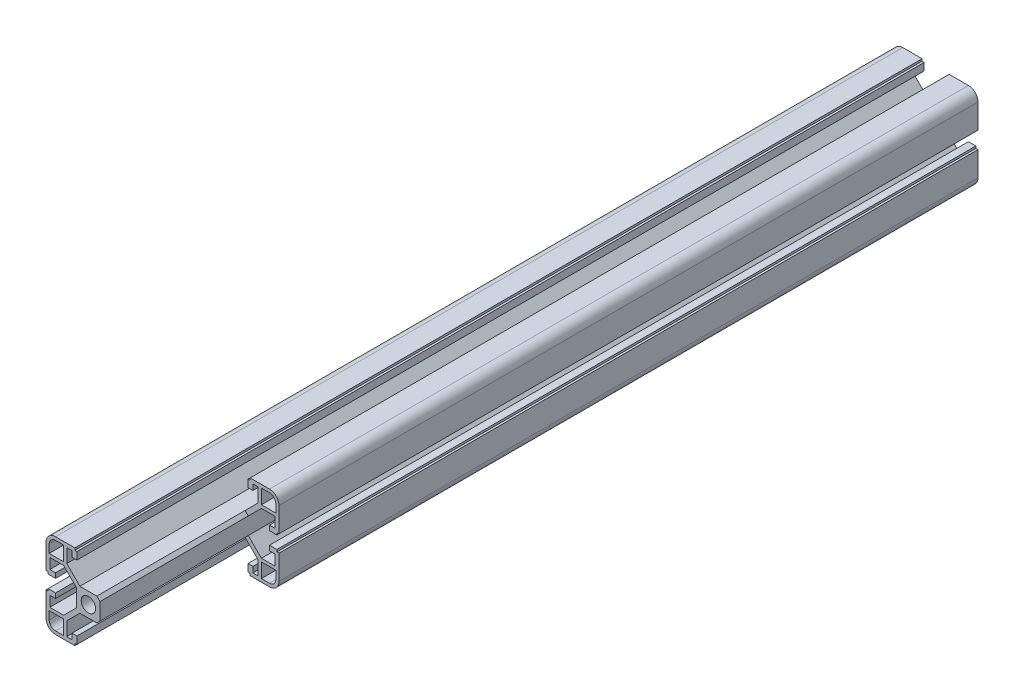
from build123d import *
from build123d.topology import SkipClean

# Parameters (mm, degrees)
BOSS_EXTRUDE1_DEPTH   = 400
MIRROR3_COPY_1_DEPTH  = 400
MIRROR3_COPY_2_DEPTH  = 400
CORTAR_EXTRUIR2_DEPTH = 70


with BuildPart() as part:
    # Sketch1 → Boss-Extrude1 (new body)
    with BuildSketch(Plane.XY):
        with BuildLine():
            Line((3.4, 0), (5.5, 0))
            Line((5.5, 0), (5.5, 4))
            Line((5.5, 4), (11.69, 10.19))
            Line((11.69, 10.19), (18.2, 10.19))
            Line((18.2, 10.19), (18.2, 5.265595036))
            Line((18.2, 5.265595036), (15.5, 5.265595036))
            Line((15.5, 5.265595036), (15.5, 2.965595036))
            Line((15.5, 2.965595036), (19, 2.965595036))
            Line((19, 2.965595036), (19, 3.965595036))
            Line((19, 3.965595036), (20, 3.965595036))
            Line((20, 3.965595036), (20, 15.5))
            ThreePointArc((20, 15.5), (18.681980515, 18.681980515), (15.5, 20))
            Line((15.5, 20), (6.385304712, 20))
            Line((6.385304712, 20), (6.385304712, 19))
            Line((6.385304712, 19), (5.385304712, 19))
            Line((5.385304712, 19), (5.385304712, 15.5))
            Line((5.385304712, 15.5), (7.685304712, 15.5))
            Line((7.685304712, 15.5), (7.685304712, 18.2))
            Line((7.685304712, 18.2), (10.19, 18.2))
            Line((10.19, 18.2), (10.19, 11.69))
            Line((10.19, 11.69), (4, 5.5))
            Line((4, 5.5), (0, 5.5))
            Line((0, 5.5), (0, 3.4))
            ThreePointArc((0, 3.4), (2.404163056, 2.404163056), (3.4, 0))
        make_face()
        with BuildLine():
            Line((18.5, 11.69), (18.5, 15.5))
            ThreePointArc((18.5, 15.5), (17.621320344, 17.621320344), (15.5, 18.5))
            Line((15.5, 18.5), (11.69, 18.5))
            Line((11.69, 18.5), (11.69, 11.69))
            Line((11.69, 11.69), (18.5, 11.69))
        make_face(mode=Mode.SUBTRACT)
    boss_extrude1 = extrude(amount=BOSS_EXTRUDE1_DEPTH)

    # Mirror1: Boss-Extrude1 across plane
    add(boss_extrude1.mirror(Plane.ZX))

    # Mirror2: Boss-Extrude1 across plane
    add(boss_extrude1.mirror(Plane(origin=(0, 0, 0), x_dir=(0, 0, 1), z_dir=(1, 0, 0))))

    # Mirror3 copy 1 sketch → Mirror3 copy 1 (add)
    with BuildSketch(Plane(origin=(0, 0, 0), x_dir=(-1, 0, 0), z_dir=(0, 0, 1))):
        with BuildLine():
            Line((3.4, 0), (5.5, 0))
            Line((5.5, 0), (5.5, 4))
            Line((5.5, 4), (11.69, 10.19))
            Line((11.69, 10.19), (18.2, 10.19))
            Line((18.2, 10.19), (18.2, 5.265595036))
            Line((18.2, 5.265595036), (15.5, 5.265595036))
            Line((15.5, 5.265595036), (15.5, 2.965595036))
            Line((15.5, 2.965595036), (19, 2.965595036))
            Line((19, 2.965595036), (19, 3.965595036))
            Line((19, 3.965595036), (20, 3.965595036))
            Line((20, 3.965595036), (20, 15.5))
            ThreePointArc((20, 15.5), (18.681980515, 18.681980515), (15.5, 20))
            Line((15.5, 20), (6.385304712, 20))
            Line((6.385304712, 20), (6.385304712, 19))
            Line((6.385304712, 19), (5.385304712, 19))
            Line((5.385304712, 19), (5.385304712, 15.5))
            Line((5.385304712, 15.5), (7.685304712, 15.5))
            Line((7.685304712, 15.5), (7.685304712, 18.2))
            Line((7.685304712, 18.2), (10.19, 18.2))
            Line((10.19, 18.2), (10.19, 11.69))
            Line((10.19, 11.69), (4, 5.5))
            Line((4, 5.5), (0, 5.5))
            Line((0, 5.5), (0, 3.4))
            ThreePointArc((0, 3.4), (2.404163056, 2.404163056), (3.4, 0))
        make_face()
        with BuildLine():
            Line((18.5, 11.69), (18.5, 15.5))
            ThreePointArc((18.5, 15.5), (17.621320344, 17.621320344), (15.5, 18.5))
            Line((15.5, 18.5), (11.69, 18.5))
            Line((11.69, 18.5), (11.69, 11.69))
            Line((11.69, 11.69), (18.5, 11.69))
        make_face(mode=Mode.SUBTRACT)
    extrude(amount=MIRROR3_COPY_1_DEPTH)

    # Mirror3 copy 2 sketch → Mirror3 copy 2 (add)
    with SkipClean():  # the faces are left unmerged after this step: merging them gives an invalid solid
        with BuildSketch(Plane.XY):
            with BuildLine():
                Line((3.4, 0), (5.5, 0))
                Line((5.5, 0), (5.5, -4))
                Line((5.5, -4), (11.69, -10.19))
                Line((11.69, -10.19), (18.2, -10.19))
                Line((18.2, -10.19), (18.2, -5.265595036))
                Line((18.2, -5.265595036), (15.5, -5.265595036))
                Line((15.5, -5.265595036), (15.5, -2.965595036))
                Line((15.5, -2.965595036), (19, -2.965595036))
                Line((19, -2.965595036), (19, -3.965595036))
                Line((19, -3.965595036), (20, -3.965595036))
                Line((20, -3.965595036), (20, -15.5))
                ThreePointArc((20, -15.5), (18.681980515, -18.681980515), (15.5, -20))
                Line((15.5, -20), (6.385304712, -20))
                Line((6.385304712, -20), (6.385304712, -19))
                Line((6.385304712, -19), (5.385304712, -19))
                Line((5.385304712, -19), (5.385304712, -15.5))
                Line((5.385304712, -15.5), (7.685304712, -15.5))
                Line((7.685304712, -15.5), (7.685304712, -18.2))
                Line((7.685304712, -18.2), (10.19, -18.2))
                Line((10.19, -18.2), (10.19, -11.69))
                Line((10.19, -11.69), (4, -5.5))
                Line((4, -5.5), (0, -5.5))
                Line((0, -5.5), (0, -3.4))
                ThreePointArc((0, -3.4), (2.404163056, -2.404163056), (3.4, 0))
            make_face()
            with BuildLine():
                Line((18.5, -11.69), (18.5, -15.5))
                ThreePointArc((18.5, -15.5), (17.621320344, -17.621320344), (15.5, -18.5))
                Line((15.5, -18.5), (11.69, -18.5))
                Line((11.69, -18.5), (11.69, -11.69))
                Line((11.69, -11.69), (18.5, -11.69))
            make_face(mode=Mode.SUBTRACT)
        extrude(amount=MIRROR3_COPY_2_DEPTH)

    # Croquis2 → Cortar-Extruir2 (cut)
    with SkipClean():  # the faces are left unmerged after this step: merging them gives an invalid solid
        with BuildSketch(Plane.XY.offset(400)):
            Polygon((4, 5.5), (5.5, 4), (5.5, -4), (4, -5.5), (4, -23.233450201), (29.730569107, -23.233450201), (29.730569107, 32.126808521), (4, 32.126808521), align=None)
        extrude(amount=-CORTAR_EXTRUIR2_DEPTH, mode=Mode.SUBTRACT)


solid = part.part
